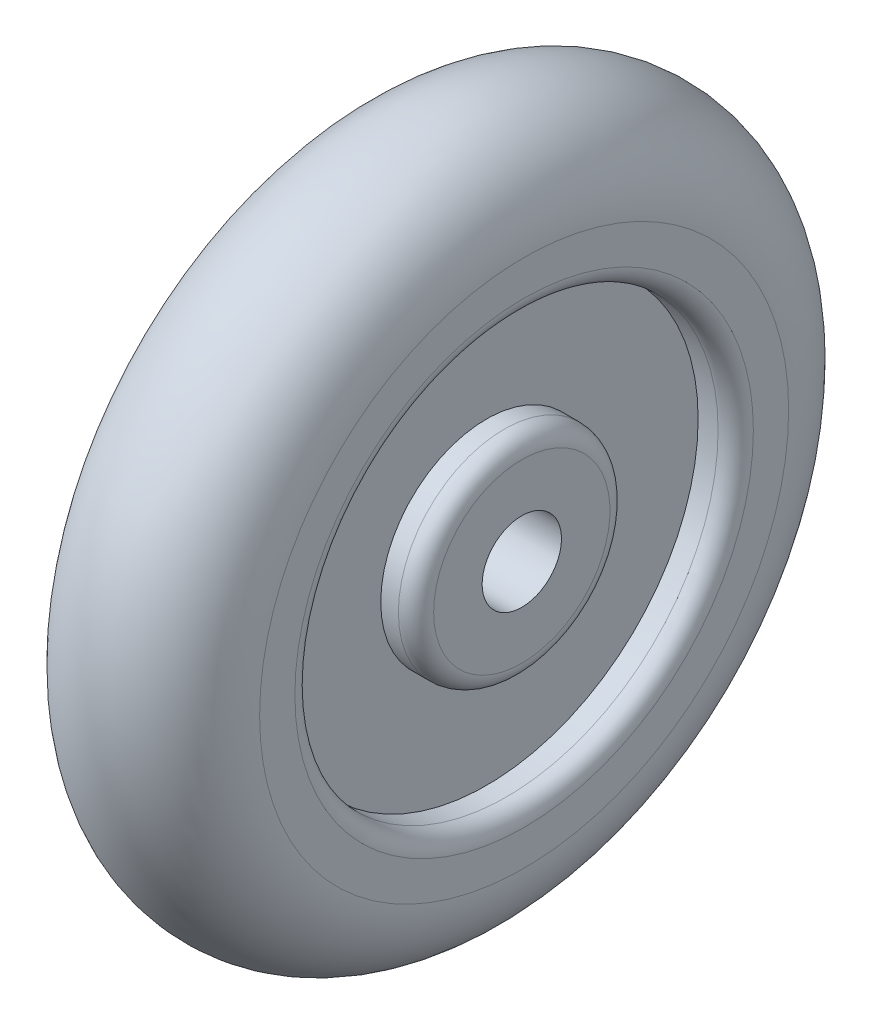
from build123d import *

# Parameters (mm, degrees)
SKETCH_2_R          = 2.25
CUT_EXTRUDE_1_DEPTH = 31.043970418
FILLET_6_R          = 1
FILLET_7_R          = 1
FILLET_9_R          = 1


with BuildPart() as part:
    # 草圖1 → 旋轉2 (revolve)
    with BuildSketch(Plane.XY, mode=Mode.PRIVATE) as revolve_2_sk:
        with BuildLine():
            Line((-2.933789322, 0), (-2.933789322, 6))
            Line((-2.933789322, 6), (-0.933789322, 6))
            Line((-0.933789322, 6), (-0.933789322, 12))
            Line((-0.933789322, 12), (-2.802641781, 12))
            Line((-2.802641781, 12), (-2.802641781, 15))
            ThreePointArc((-2.802641781, 15), (2.197358219, 20), (7.197358219, 15))
            Line((7.197358219, 15), (7.197358219, 12))
            Line((7.197358219, 12), (5.066210678, 12))
            Line((5.066210678, 12), (5.066210678, 6))
            Line((5.066210678, 6), (7.066210678, 6))
            Line((7.066210678, 6), (7.066210678, 0))
            Line((7.066210678, 0), (-2.933789322, 0))
        make_face()
    revolve(revolve_2_sk.sketch.rotate(Axis((-6.696084404, 0, 0), (1, 0, 0)), 90), axis=Axis((-6.696084404, 0, 0), (1, 0, 0)))

    # 草圖2 → 除料-伸長1 (cut, through all)
    with BuildSketch(Plane.ZY.offset(2.933789322)):
        Circle(SKETCH_2_R)
    extrude(amount=-CUT_EXTRUDE_1_DEPTH, mode=Mode.SUBTRACT)

    # 圓角6
    fillet_6_edges = [part.edges().sort_by_distance(p)[0] for p in [
        (-0.933789322, 0, -6),
        (-0.933789322, 0, -12),
        (-2.933789322, 0, -6),
    ]]
    fillet(fillet_6_edges, radius=FILLET_6_R - 0.0001)  # a hair under: the kernel refuses the full size

    # 圓角7
    fillet_7_edges = [part.edges().sort_by_distance(p)[0] for p in [
        (-2.802641781, 0, -12),
    ]]
    fillet(fillet_7_edges, radius=FILLET_7_R)

    # 圓角9
    fillet_9_edges = [part.edges().sort_by_distance(p)[0] for p in [
        (7.197358219, 0, -12),
        (7.066210678, 0, -6),
    ]]
    fillet(fillet_9_edges, radius=FILLET_9_R)


solid = part.part
